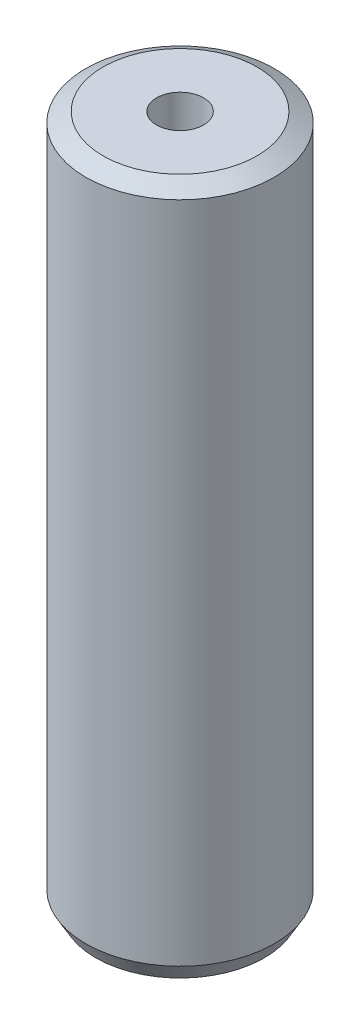
from build123d import *
from OCP.BRepFilletAPI import BRepFilletAPI_MakeChamfer

# Parameters (mm, degrees)
SKETCH1_R           = 10
BOSS_EXTRUDE1_DEPTH = 73.315638498
SKETCH2_R           = 2.498457772
CUT_EXTRUDE1_DEPTH  = 75.667147049
CHAMFER1_SIZE       = 1.054706384
CHAMFER1_SIZE2      = 1.826805043


with BuildPart() as part:
    # Sketch1 → Boss-Extrude1 (new body)
    with BuildSketch(Plane(origin=(0, 0, 0), x_dir=(1, 0, 0), z_dir=(0, 1, 0))):
        Circle(SKETCH1_R)
    extrude(amount=BOSS_EXTRUDE1_DEPTH)

    # Sketch2 → Cut-Extrude1 (cut, through all)
    with BuildSketch(Plane(origin=(0, 0, 0), x_dir=(1, 0, 0), z_dir=(0, 1, 0))):
        Circle(SKETCH2_R)
    extrude(amount=CUT_EXTRUDE1_DEPTH, mode=Mode.SUBTRACT)

    # Chamfer1: one chamfer whose edges measure the first distance from different faces: ONE call of the kernel's chamfer builder (chamfer() names one face for all edges)
    chamfer1_edges_1 = [part.edges().sort_by_distance(p)[0] for p in [
        (-10, 73.315638498, 0),
    ]]
    chamfer1_side_1 = [part.faces().sort_by_distance(p)[0] for p in [
        (-10, 36.657819249, 0),
    ]]
    chamfer1_edges_2 = [part.edges().sort_by_distance(p)[0] for p in [
        (-10, 0, 0),
    ]]
    chamfer1_side_2 = [part.faces().sort_by_distance(p)[0] for p in [
        (-9.717157288, 0, 0),
    ]]
    chamfer1 = BRepFilletAPI_MakeChamfer(part.part.solid().wrapped)
    for e in chamfer1_edges_1:
        chamfer1.Add(CHAMFER1_SIZE, CHAMFER1_SIZE2, e.wrapped, chamfer1_side_1[0].wrapped)  # the first distance lies on this face
    for e in chamfer1_edges_2:
        chamfer1.Add(CHAMFER1_SIZE, CHAMFER1_SIZE2, e.wrapped, chamfer1_side_2[0].wrapped)  # the first distance lies on this face
    add(Compound.cast(chamfer1.Shape()), mode=Mode.REPLACE)


solid = part.part
